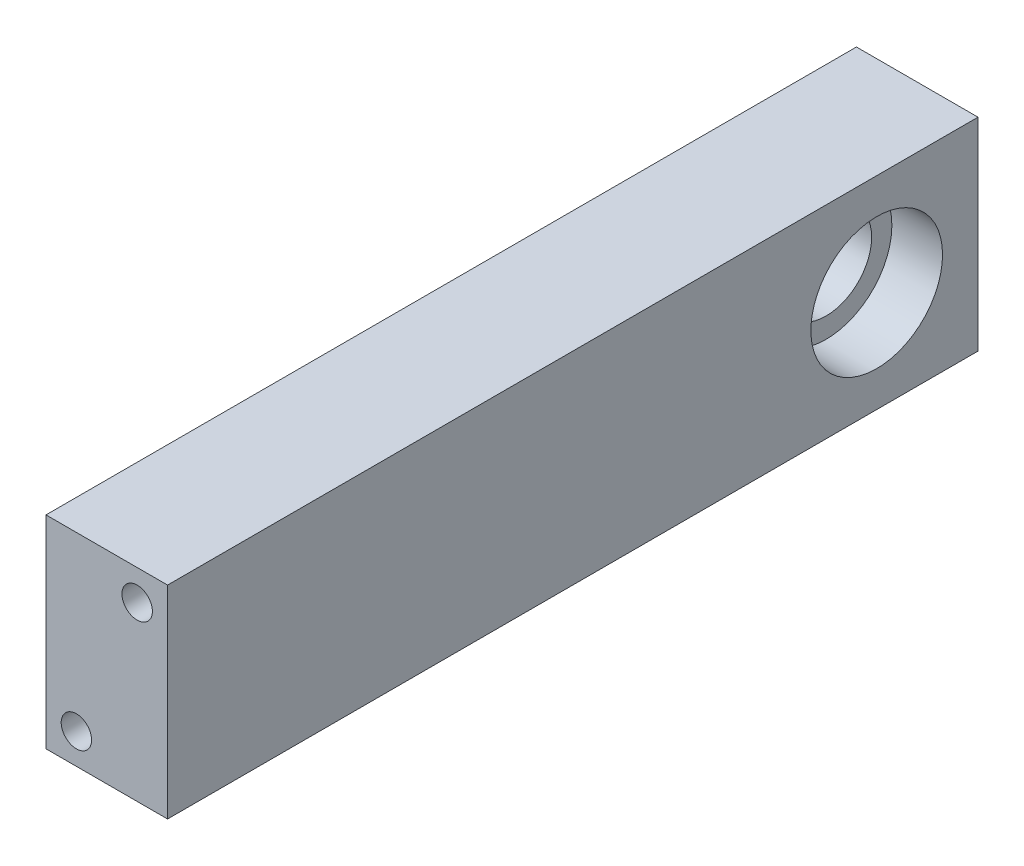
from build123d import *

# Parameters (mm, degrees)
SZKIC1_W                    = 12
SZKIC1_H                    = 20
DODANIE_WYCI_GNI_CIE1_DEPTH = 80
SZKIC2_R                    = 1.5
WYTNIJ_WYCI_GNI_CIE1_DEPTH  = 10
SZKIC5_R                    = 6.5
WYTNIJ_WYCI_GNI_CIE4_DEPTH  = 5
SZKIC6_R                    = 4.5
WYTNIJ_WYCI_GNI_CIE5_DEPTH  = 82.510735489


with BuildPart() as part:
    # Szkic1 → Dodanie-wyciągnięcie1 (new body)
    with BuildSketch(Plane.XY):
        Rectangle(SZKIC1_W, SZKIC1_H)
    extrude(amount=DODANIE_WYCI_GNI_CIE1_DEPTH)

    # Szkic2 → Wytnij-wyciągnięcie1 (cut)
    with BuildSketch(Plane.XY.offset(80)):
        with Locations((3, 7)):
            Circle(SZKIC2_R)
        with Locations((-3, -7)):
            Circle(SZKIC2_R)
    extrude(amount=-WYTNIJ_WYCI_GNI_CIE1_DEPTH, mode=Mode.SUBTRACT)

    # Szkic5 → Wytnij-wyciągnięcie4 (cut)
    with BuildSketch(Plane(origin=(6, 0, 0), x_dir=(0, 0, -1), z_dir=(1, 0, 0))):
        with Locations((-10, 0)):
            Circle(SZKIC5_R)
    extrude(amount=-WYTNIJ_WYCI_GNI_CIE4_DEPTH, mode=Mode.SUBTRACT)

    # Szkic6 → Wytnij-wyciągnięcie5 (cut, through all)
    with BuildSketch(Plane.ZY.offset(6)):
        with Locations((10, 0)):
            Circle(SZKIC6_R)
    extrude(amount=-WYTNIJ_WYCI_GNI_CIE5_DEPTH, mode=Mode.SUBTRACT)


solid = part.part
